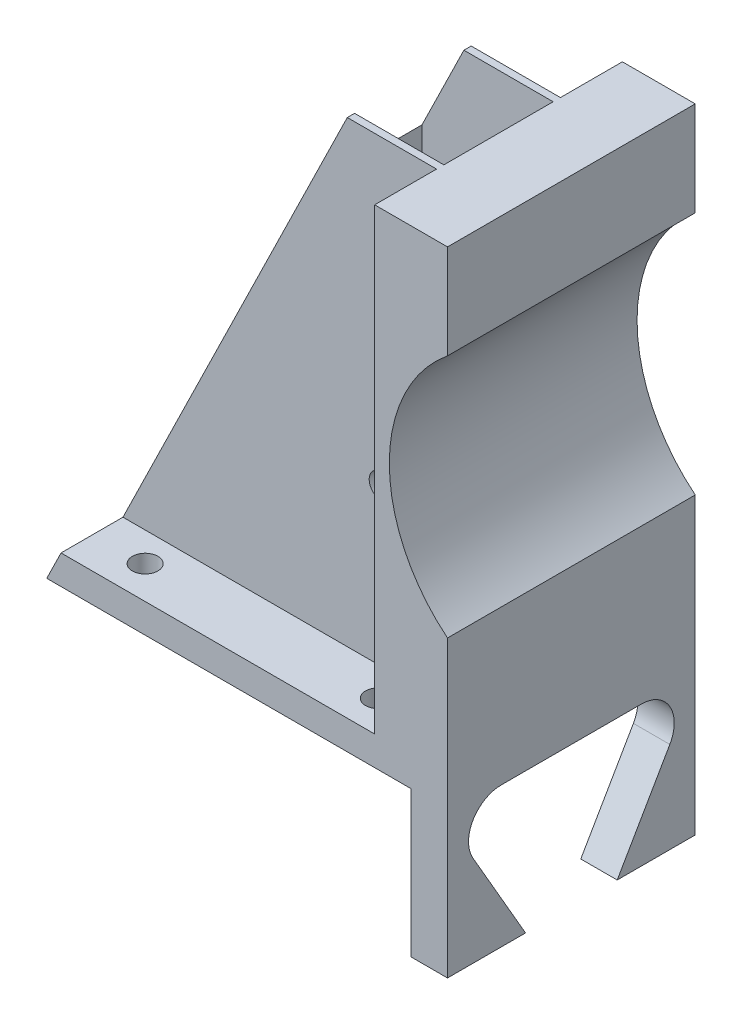
from build123d import *

# Parameters (mm, degrees)
BOSS_EXTRUDE2_DEPTH = 34
SKETCH5_W           = 50
SKETCH5_H           = 20
CUT_EXTRUDE1_DEPTH  = 8.5
SKETCH6_W           = 50
SKETCH6_H           = 20
CUT_EXTRUDE2_DEPTH  = 8.5
SKETCH7_W           = 52.006330756
SKETCH7_H           = 21.627895193
CUT_EXTRUDE3_DEPTH  = 87.390073596
CUT_EXTRUDE4_DEPTH  = 101.468874862
SKETCH10_R          = 1.75
CUT_EXTRUDE5_DEPTH  = 10
SKETCH14_W          = 15
SKETCH14_H          = 37
CUT_EXTRUDE8_DEPTH  = 18
SKETCH15_W          = 18
SKETCH15_H          = 15
CUT_EXTRUDE9_DEPTH  = 9
SKETCH16_W          = 13
SKETCH16_H          = 9
CUT_EXTRUDE10_DEPTH = 96.362439231
SKETCH17_R          = 1.75
CUT_EXTRUDE11_DEPTH = 87.390073596


with BuildPart() as part:
    # Sketch4 → Boss-Extrude2 (new body)
    with BuildSketch(Plane.XY):
        with BuildLine():
            Line((-25, -10), (30, -10))
            Line((30, -10), (30, 30.414))
            ThreePointArc((30, 30.414), (22.015013929, 47.178), (30, 63.942))
            Line((30, 63.942), (30, 76.896))
            Line((30, 76.896), (7.747226033, 76.896))
            Line((7.747226033, 76.896), (-25, 10))
            Line((-25, 10), (-25, -10))
        make_face()
    extrude(amount=BOSS_EXTRUDE2_DEPTH)

    # Sketch5 → Cut-Extrude1 (cut)
    with BuildSketch(Plane.XY.offset(34)):
        Polygon((-23.041902294, 14), (7.747226033, 76.896), (20, 76.896), (20, 14), align=None)
        Rectangle(SKETCH5_W, SKETCH5_H)
    extrude(amount=-CUT_EXTRUDE1_DEPTH, mode=Mode.SUBTRACT)

    # Sketch6 → Cut-Extrude2 (cut)
    with BuildSketch(Plane(origin=(0, 0, 0), x_dir=(-1, 0, 0), z_dir=(0, 0, -1))):
        Polygon((23.041902294, 14), (-20, 14), (-20, 76.896), (-7.747226033, 76.896), align=None)
        Rectangle(SKETCH6_W, SKETCH6_H)
    extrude(amount=-CUT_EXTRUDE2_DEPTH, mode=Mode.SUBTRACT)

    # Sketch7 → Cut-Extrude3 (cut, through all)
    with BuildSketch(Plane(origin=(0, 0, 8.5), x_dir=(-1, 0, 0), z_dir=(0, 0, -1))):
        with Locations((1.003165378, -0.813947597)):
            Rectangle(SKETCH7_W, SKETCH7_H)
    extrude(amount=-CUT_EXTRUDE3_DEPTH, mode=Mode.SUBTRACT)

    # Sketch9 → Cut-Extrude4 (cut, through all)
    with BuildSketch(Plane(origin=(30, 0, 0), x_dir=(0, 0, -1), z_dir=(1, 0, 0))):
        with BuildLine():
            Line((-26.615, 9.257), (-7.385, 9.257))
            ThreePointArc((-7.385, 9.257), (-3.487778361, 7.006814103), (-3.488100353, 2.506628222))
            Line((-3.488100353, 2.506628222), (-13.103100353, -14.143371778))
            ThreePointArc((-13.103100353, -14.143371778), (-17, -16.393), (-20.896899647, -14.143371778))
            Line((-20.896899647, -14.143371778), (-30.511899647, 2.506628222))
            ThreePointArc((-30.511899647, 2.506628222), (-30.512221639, 7.006814103), (-26.615, 9.257))
        make_face()
    extrude(amount=-CUT_EXTRUDE4_DEPTH, mode=Mode.SUBTRACT)

    # Sketch10 → Cut-Extrude5 (cut)
    with BuildSketch(Plane.XZ.offset(-10)):
        with Locations((16, 29.5)):
            Circle(SKETCH10_R)
        with Locations((16, 4.5)):
            Circle(SKETCH10_R)
        with Locations((-16, 29.5)):
            Circle(SKETCH10_R)
        with Locations((-16, 4.5)):
            Circle(SKETCH10_R)
    extrude(amount=-CUT_EXTRUDE5_DEPTH, mode=Mode.SUBTRACT)

    # Sketch14 → Cut-Extrude8 (cut)
    with BuildSketch(Plane.ZY.offset(-20)):
        with Locations((17, 58.396)):
            Rectangle(SKETCH14_W, SKETCH14_H)
    extrude(amount=CUT_EXTRUDE8_DEPTH, mode=Mode.SUBTRACT)

    # Sketch15 → Cut-Extrude9 (cut)
    with BuildSketch(Plane(origin=(0, 39.896, 0), x_dir=(1, 0, 0), z_dir=(0, 1, 0))):
        with Locations((11, -17)):
            Rectangle(SKETCH15_W, SKETCH15_H)
    extrude(amount=-CUT_EXTRUDE9_DEPTH, mode=Mode.SUBTRACT)

    # Sketch16 → Cut-Extrude10 (cut, through all)
    with BuildSketch(Plane.ZY.offset(-20)):
        with Locations((17, 35.396)):
            Rectangle(SKETCH16_W, SKETCH16_H)
    extrude(amount=CUT_EXTRUDE10_DEPTH, mode=Mode.SUBTRACT)

    # Sketch17 → Cut-Extrude11 (cut, through all)
    with BuildSketch(Plane.XY.offset(25.5)):
        with Locations((12.5, 35.396)):
            Circle(SKETCH17_R)
    extrude(amount=-CUT_EXTRUDE11_DEPTH, mode=Mode.SUBTRACT)


solid = part.part
